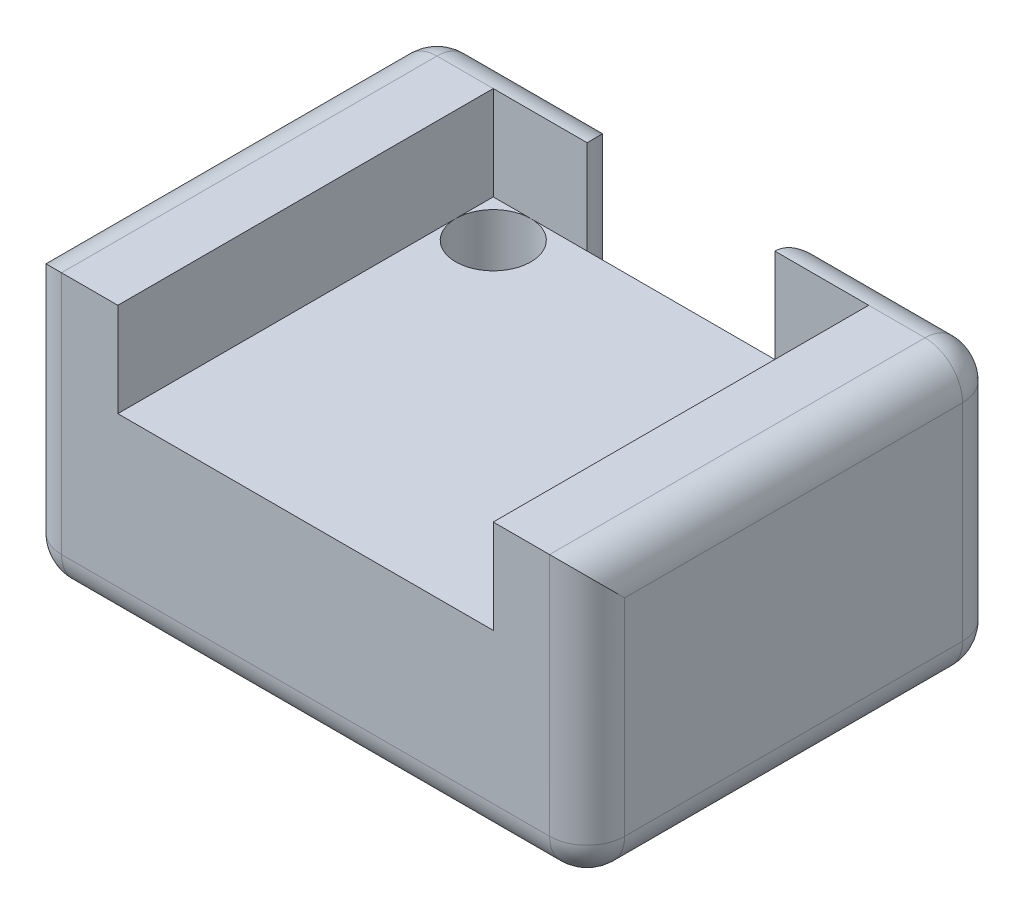
from build123d import *

# Parameters (mm, degrees)
SKETCH1_W           = 30
SKETCH1_H           = 30
BOSS_EXTRUDE2_DEPTH = 15
SKETCH3_W           = 20
SKETCH3_H           = 20
CUT_EXTRUDE1_DEPTH  = 5
SKETCH4_R           = 5
CUT_EXTRUDE2_DEPTH  = 8
SKETCH7_R           = 2
CUT_EXTRUDE4_DEPTH  = 25
SKETCH8_W           = 10
SKETCH8_H           = 10
CUT_EXTRUDE7_DEPTH  = 25
SKETCH9_W           = 30
SKETCH9_H           = 8
CUT_EXTRUDE8_DEPTH  = 25
FILLET1_R           = 2
FILLET2_R           = 2


with BuildPart() as part:
    # Sketch1 → Boss-Extrude2 (new body)
    with BuildSketch(Plane(origin=(0, 0, 0), x_dir=(1, 0, 0), z_dir=(0, 1, 0))):
        with Locations((15, 15)):
            Rectangle(SKETCH1_W, SKETCH1_H)
    extrude(amount=BOSS_EXTRUDE2_DEPTH)

    # Sketch3 → Cut-Extrude1 (cut)
    with BuildSketch(Plane(origin=(0, 15, 0), x_dir=(1, 0, 0), z_dir=(0, 1, 0))):
        with Locations((15, 10)):
            Rectangle(SKETCH3_W, SKETCH3_H)
    extrude(amount=-CUT_EXTRUDE1_DEPTH, mode=Mode.SUBTRACT)

    # Sketch4 → Cut-Extrude2 (cut)
    with BuildSketch(Plane.XZ):
        with Locations(Location((15, -11, 0), (0, 0, 270))):
            Circle(SKETCH4_R)
    extrude(amount=-CUT_EXTRUDE2_DEPTH, mode=Mode.SUBTRACT)

    # Sketch7 → Cut-Extrude4 (cut)
    with BuildSketch(Plane(origin=(0, 10, 0), x_dir=(1, 0, 0), z_dir=(0, 1, 0))):
        with Locations(Location((7, 18, 0), (0, 0, 90))):
            Circle(SKETCH7_R)
        with Locations(Location((23, 18, 0), (0, 0, 90))):
            Circle(SKETCH7_R)
    extrude(amount=-CUT_EXTRUDE4_DEPTH, mode=Mode.SUBTRACT)

    # Sketch8 → Cut-Extrude7 (cut)
    with BuildSketch(Plane(origin=(0, 15, 0), x_dir=(1, 0, 0), z_dir=(0, 1, 0))):
        with Locations((15, 25)):
            Rectangle(SKETCH8_W, SKETCH8_H)
    extrude(amount=-CUT_EXTRUDE7_DEPTH, mode=Mode.SUBTRACT)

    # Sketch9 → Cut-Extrude8 (cut)
    with BuildSketch(Plane(origin=(0, 15, 0), x_dir=(1, 0, 0), z_dir=(0, 1, 0))):
        with Locations((15, 26)):
            Rectangle(SKETCH9_W, SKETCH9_H)
    extrude(amount=-CUT_EXTRUDE8_DEPTH, mode=Mode.SUBTRACT)

    # Fillet1
    # the kernel refuses this fillet: 2 mm, written as the material it takes off along each edge
    with BuildSketch(Plane(origin=(20, 0, -20), x_dir=(1, 0, 0), z_dir=(0, 0, -1)), Plane(origin=(10, 0, -27), x_dir=(-1, 0, 0), z_dir=(0, 0, 1))) as fillet1_piece_1:
        with BuildLine():
            CenterArc((FILLET1_R, -FILLET1_R), FILLET1_R, 90, 90)
            Line((0, -FILLET1_R), (0, 0))
            Line((0, 0), (FILLET1_R, 0))
        make_face()
    extrude(amount=7, mode=Mode.SUBTRACT)
    with BuildSketch(Plane(origin=(10, 0, -20), x_dir=(0, 0, 1), z_dir=(1, 0, 0))) as fillet1_piece_2:
        with BuildLine():
            CenterArc((FILLET1_R, -FILLET1_R), FILLET1_R, 90, 90)
            Line((0, -FILLET1_R), (0, 0))
            Line((0, 0), (FILLET1_R, 0))
        make_face()
    extrude(amount=10, mode=Mode.SUBTRACT)
    with BuildSketch(Plane(origin=(15, 0, -22), x_dir=(0, 0, 1), z_dir=(-1, 0, 0)), Plane(origin=(35, 0, -22), x_dir=(0, 0, 1), z_dir=(-1, 0, 0))) as fillet1_piece_3:
        with BuildLine():
            CenterArc((FILLET1_R, FILLET1_R), FILLET1_R, 180, 90)
            Line((0, FILLET1_R), (0, 0))
            Line((0, 0), (FILLET1_R, 0))
        make_face()
    extrude(amount=20, mode=Mode.SUBTRACT)
    with BuildSketch(Plane(origin=(0, 0, -27), x_dir=(1, 0, 0), z_dir=(0, 0, 1)), Plane(origin=(30, 0, 5), x_dir=(-1, 0, 0), z_dir=(0, 0, -1))) as fillet1_piece_4:
        with BuildLine():
            CenterArc((FILLET1_R, FILLET1_R), FILLET1_R, 180, 90)
            Line((0, FILLET1_R), (0, 0))
            Line((0, 0), (FILLET1_R, 0))
        make_face()
    extrude(amount=32, mode=Mode.SUBTRACT)
    with BuildSketch(Plane(origin=(-5, 0, 0), x_dir=(0, 1, 0), z_dir=(1, 0, 0))) as fillet1_piece_5:
        with BuildLine():
            CenterArc((FILLET1_R, -FILLET1_R), FILLET1_R, 90, 90)
            Line((0, -FILLET1_R), (0, 0))
            Line((0, 0), (FILLET1_R, 0))
        make_face()
    extrude(amount=40, mode=Mode.SUBTRACT)
    with BuildSketch(Plane(origin=(10, 0, -20), x_dir=(0, 0, 1), z_dir=(1, 0, 0))) as fillet1_piece_6a_section:
        with BuildLine():
            CenterArc((FILLET1_R, -FILLET1_R), FILLET1_R, 90, 90)
            Line((0, -FILLET1_R), (0, 0))
            Line((0, 0), (FILLET1_R, 0))
        make_face()
    fillet1_piece_6a = extrude(amount=15, mode=Mode.PRIVATE)
    fillet1_piece_6a = split(fillet1_piece_6a, bisect_by=Plane(origin=(20, 0.452790229, -19.547209771), z_dir=(1, 0, 0)), keep=Keep.TOP, mode=Mode.PRIVATE)
    with BuildSketch(Plane(origin=(20, 0, -15), x_dir=(1, 0, 0), z_dir=(0, 0, -1))) as fillet1_piece_6b_section:
        with BuildLine():
            CenterArc((FILLET1_R, -FILLET1_R), FILLET1_R, 90, 90)
            Line((0, -FILLET1_R), (0, 0))
            Line((0, 0), (FILLET1_R, 0))
        make_face()
    fillet1_piece_6b = extrude(amount=12, mode=Mode.PRIVATE)
    fillet1_piece_6b = split(fillet1_piece_6b, bisect_by=Plane(origin=(20.452790229, 0.452790229, -20), z_dir=(0, 0, 1)), keep=Keep.TOP, mode=Mode.PRIVATE)
    fillet1_piece_6 = fillet1_piece_6a & fillet1_piece_6b
    add(fillet1_piece_6, mode=Mode.SUBTRACT)
    with BuildSketch(Plane(origin=(10, 0, -27), x_dir=(-1, 0, 0), z_dir=(0, 0, 1))) as fillet1_piece_7a_section:
        with BuildLine():
            CenterArc((FILLET1_R, -FILLET1_R), FILLET1_R, 90, 90)
            Line((0, -FILLET1_R), (0, 0))
            Line((0, 0), (FILLET1_R, 0))
        make_face()
    fillet1_piece_7a = extrude(amount=12, mode=Mode.PRIVATE)
    fillet1_piece_7a = split(fillet1_piece_7a, bisect_by=Plane(origin=(9.547209771, 0.452790229, -20), z_dir=(0, 0, 1)), keep=Keep.TOP, mode=Mode.PRIVATE)
    with BuildSketch(Plane(origin=(5, 0, -20), x_dir=(0, 0, 1), z_dir=(1, 0, 0))) as fillet1_piece_7b_section:
        with BuildLine():
            CenterArc((FILLET1_R, -FILLET1_R), FILLET1_R, 90, 90)
            Line((0, -FILLET1_R), (0, 0))
            Line((0, 0), (FILLET1_R, 0))
        make_face()
    fillet1_piece_7b = extrude(amount=15, mode=Mode.PRIVATE)
    fillet1_piece_7b = split(fillet1_piece_7b, bisect_by=Plane(origin=(10, 0.452790229, -19.547209771), z_dir=(-1, 0, 0)), keep=Keep.TOP, mode=Mode.PRIVATE)
    fillet1_piece_7 = fillet1_piece_7a & fillet1_piece_7b
    add(fillet1_piece_7, mode=Mode.SUBTRACT)

    # Fillet2
    # the kernel refuses this fillet: 2 mm, written as the material it takes off along each edge
    with BuildSketch(Plane(origin=(2, 2, -2), x_dir=(-1, 0, 0), z_dir=(0, 0, 1))) as fillet2_piece_1_section:
        Polygon((0, 0), (FILLET2_R, 0), (FILLET2_R, FILLET2_R), (0, FILLET2_R), align=None)
    fillet2_piece_1 = extrude(amount=FILLET2_R, mode=Mode.PRIVATE)
    fillet2_piece_1 = fillet2_piece_1 - Plane(origin=(2, 2, -2), x_dir=(0.7071067811865475, 0.7071067811865475, 0), z_dir=(0, 0, 1)) * Sphere(FILLET2_R, mode=Mode.PRIVATE)
    add(fillet2_piece_1, mode=Mode.SUBTRACT)
    with BuildSketch(Plane(origin=(2, 2, -20), x_dir=(0, 0, -1), z_dir=(-1, 0, 0))) as fillet2_piece_2_section:
        Polygon((0, 0), (FILLET2_R, 0), (FILLET2_R, FILLET2_R), (0, FILLET2_R), align=None)
    fillet2_piece_2 = extrude(amount=FILLET2_R, mode=Mode.PRIVATE)
    fillet2_piece_2 = fillet2_piece_2 - Plane(origin=(2, 2, -20), x_dir=(0, 0.7071067811865475, 0.7071067811865475), z_dir=(-1, 0, 0)) * Sphere(FILLET2_R, mode=Mode.PRIVATE)
    add(fillet2_piece_2, mode=Mode.SUBTRACT)
    with BuildSketch(Plane(origin=(8, 2, -20), x_dir=(1, 0, 0), z_dir=(0, 0, -1))) as fillet2_piece_3_section:
        Polygon((0, 0), (FILLET2_R, 0), (FILLET2_R, FILLET2_R), (0, FILLET2_R), align=None)
    fillet2_piece_3 = extrude(amount=FILLET2_R, mode=Mode.PRIVATE)
    fillet2_piece_3 = fillet2_piece_3 - Plane(origin=(8, 2, -20), x_dir=(-0.7071067811865475, 0.7071067811865475, 0), z_dir=(0, 0, -1)) * Sphere(FILLET2_R, mode=Mode.PRIVATE)
    add(fillet2_piece_3, mode=Mode.SUBTRACT)
    with BuildSketch(Plane(origin=(28, 2, -2), x_dir=(1, 0, 0), z_dir=(0, 0, 1))) as fillet2_piece_4_section:
        Polygon((0, 0), (FILLET2_R, 0), (FILLET2_R, -FILLET2_R), (0, -FILLET2_R), align=None)
    fillet2_piece_4 = extrude(amount=FILLET2_R, mode=Mode.PRIVATE)
    fillet2_piece_4 = fillet2_piece_4 - Plane(origin=(28, 2, -2), x_dir=(-0.7071067811865475, 0.7071067811865475, 0), z_dir=(0, 0, 1)) * Sphere(FILLET2_R, mode=Mode.PRIVATE)
    add(fillet2_piece_4, mode=Mode.SUBTRACT)
    with BuildSketch(Plane(origin=(22, 2, -20), x_dir=(0, 0, -1), z_dir=(-1, 0, 0))) as fillet2_piece_5_section:
        Polygon((0, 0), (FILLET2_R, 0), (FILLET2_R, FILLET2_R), (0, FILLET2_R), align=None)
    fillet2_piece_5 = extrude(amount=FILLET2_R, mode=Mode.PRIVATE)
    fillet2_piece_5 = fillet2_piece_5 - Plane(origin=(22, 2, -20), x_dir=(0, 0.7071067811865475, 0.7071067811865475), z_dir=(-1, 0, 0)) * Sphere(FILLET2_R, mode=Mode.PRIVATE)
    add(fillet2_piece_5, mode=Mode.SUBTRACT)
    with BuildSketch(Plane(origin=(28, 2, -20), x_dir=(1, 0, 0), z_dir=(0, 0, -1))) as fillet2_piece_6_section:
        Polygon((0, 0), (FILLET2_R, 0), (FILLET2_R, FILLET2_R), (0, FILLET2_R), align=None)
    fillet2_piece_6 = extrude(amount=FILLET2_R, mode=Mode.PRIVATE)
    fillet2_piece_6 = fillet2_piece_6 - Plane(origin=(28, 2, -20), x_dir=(-0.7071067811865475, 0.7071067811865475, 0), z_dir=(0, 0, -1)) * Sphere(FILLET2_R, mode=Mode.PRIVATE)
    add(fillet2_piece_6, mode=Mode.SUBTRACT)
    with BuildSketch(Plane(origin=(2, 13, -20), x_dir=(0, 0, -1), z_dir=(-1, 0, 0))) as fillet2_piece_7_section:
        Polygon((0, 0), (FILLET2_R, 0), (FILLET2_R, -FILLET2_R), (0, -FILLET2_R), align=None)
    fillet2_piece_7 = extrude(amount=FILLET2_R, mode=Mode.PRIVATE)
    fillet2_piece_7 = fillet2_piece_7 - Plane(origin=(2, 13, -20), x_dir=(0, -0.7071067811865475, 0.7071067811865475), z_dir=(-1, 0, 0)) * Sphere(FILLET2_R, mode=Mode.PRIVATE)
    add(fillet2_piece_7, mode=Mode.SUBTRACT)
    with BuildSketch(Plane(origin=(28, 13, -20), x_dir=(1, 0, 0), z_dir=(0, 1, 0))) as fillet2_piece_8_section:
        Polygon((0, 0), (FILLET2_R, 0), (FILLET2_R, FILLET2_R), (0, FILLET2_R), align=None)
    fillet2_piece_8 = extrude(amount=FILLET2_R, mode=Mode.PRIVATE)
    fillet2_piece_8 = fillet2_piece_8 - Plane(origin=(28, 13, -20), x_dir=(-0.7071067811865475, 0, 0.7071067811865475), z_dir=(0, 1, 0)) * Sphere(FILLET2_R, mode=Mode.PRIVATE)
    add(fillet2_piece_8, mode=Mode.SUBTRACT)
    with BuildSketch(Plane(origin=(0, 15, -20), x_dir=(0, -1, 0), z_dir=(0, 0, 1))) as fillet2_piece_9:
        with BuildLine():
            CenterArc((FILLET2_R, FILLET2_R), FILLET2_R, 180, 90)
            Line((0, FILLET2_R), (0, 0))
            Line((0, 0), (FILLET2_R, 0))
        make_face()
    extrude(amount=25, mode=Mode.SUBTRACT)
    with BuildSketch(Plane(origin=(0, 2, 0), x_dir=(1, 0, 0), z_dir=(0, 1, 0)), Plane(origin=(20, 2, -22), x_dir=(0, 0, 1), z_dir=(0, 1, 0))) as fillet2_piece_10:
        with BuildLine():
            CenterArc((FILLET2_R, FILLET2_R), FILLET2_R, 180, 90)
            Line((0, FILLET2_R), (0, 0))
            Line((0, 0), (FILLET2_R, 0))
        make_face()
    extrude(amount=18, mode=Mode.SUBTRACT)
    with BuildSketch(Plane(origin=(15, 15, -22), x_dir=(0, -1, 0), z_dir=(-1, 0, 0)), Plane(origin=(28, 15, -22), x_dir=(0, -1, 0), z_dir=(-1, 0, 0))) as fillet2_piece_11:
        with BuildLine():
            CenterArc((FILLET2_R, FILLET2_R), FILLET2_R, 180, 90)
            Line((0, FILLET2_R), (0, 0))
            Line((0, 0), (FILLET2_R, 0))
        make_face()
    extrude(amount=13, mode=Mode.SUBTRACT)
    with BuildSketch(Plane(origin=(0, 13, -22), x_dir=(0, 0, 1), z_dir=(0, -1, 0)), Plane(origin=(30, 13, -22), x_dir=(-1, 0, 0), z_dir=(0, -1, 0))) as fillet2_piece_12:
        with BuildLine():
            CenterArc((FILLET2_R, -FILLET2_R), FILLET2_R, 90, 90)
            Line((0, -FILLET2_R), (0, 0))
            Line((0, 0), (FILLET2_R, 0))
        make_face()
    extrude(amount=11, mode=Mode.SUBTRACT)
    with BuildSketch(Plane(origin=(10, 20, -22), x_dir=(-1, 0, 0), z_dir=(0, -1, 0)), Plane(origin=(30, 2, 0), x_dir=(-1, 0, 0), z_dir=(0, 1, 0))) as fillet2_piece_13:
        with BuildLine():
            CenterArc((FILLET2_R, -FILLET2_R), FILLET2_R, 90, 90)
            Line((0, -FILLET2_R), (0, 0))
            Line((0, 0), (FILLET2_R, 0))
        make_face()
    extrude(amount=18, mode=Mode.SUBTRACT)
    with BuildSketch(Plane(origin=(30, 15, 5), x_dir=(-1, 0, 0), z_dir=(0, 0, -1))) as fillet2_piece_14:
        with BuildLine():
            CenterArc((FILLET2_R, -FILLET2_R), FILLET2_R, 90, 90)
            Line((0, -FILLET2_R), (0, 0))
            Line((0, 0), (FILLET2_R, 0))
        make_face()
    extrude(amount=25, mode=Mode.SUBTRACT)


solid = part.part
